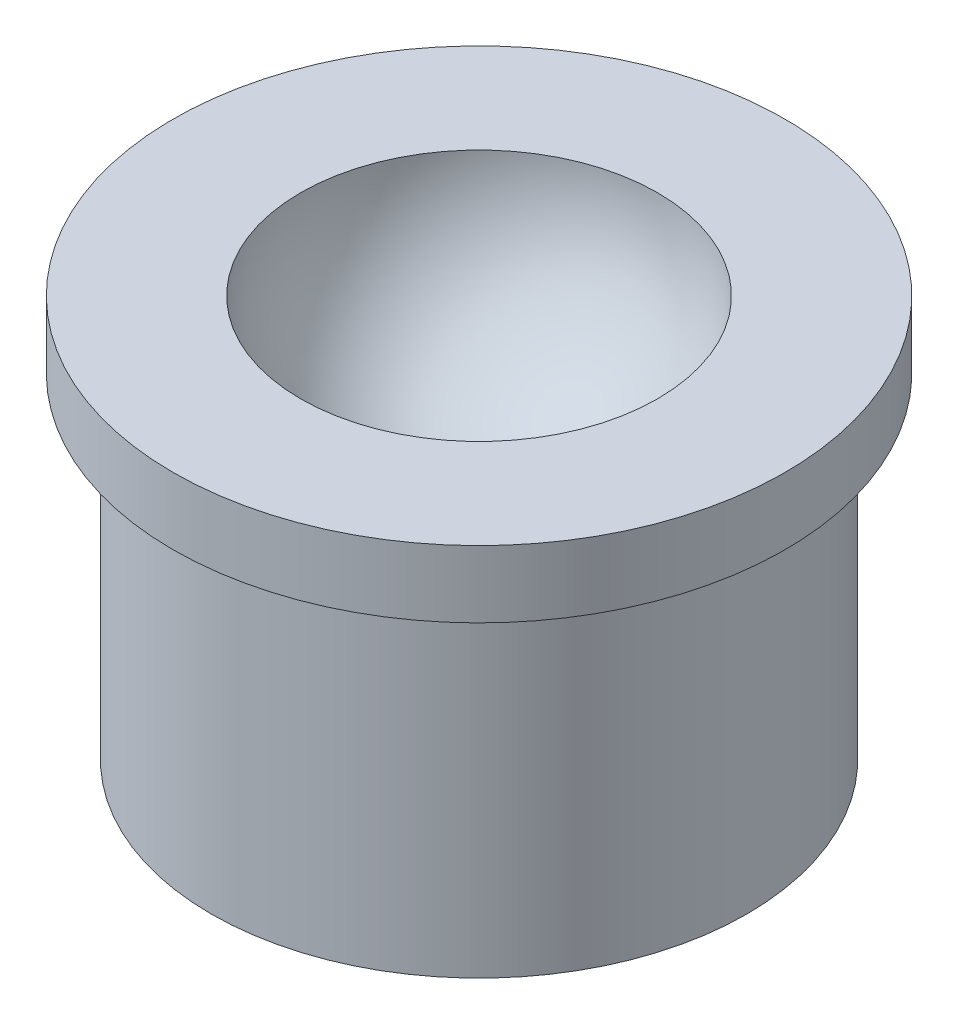
from build123d import *


with BuildPart() as part:
    # Sketch1 → Revolve1 (revolve)
    with BuildSketch(Plane.XY):
        Polygon((0, 0), (6.35, 0), (6.35, 7.9375), (7.257142857, 7.9375), (7.257142857, 9.525), (0, 9.525), align=None)
    revolve(axis=Axis((0, 15.622246456, 0), (0, -1, 0)))

    # Sketch2 → Cut-Revolve3 (revolve, cut)
    with BuildSketch(Plane.XY):
        with BuildLine():
            Line((4.233333333, 9.525), (0, 9.525))
            Line((0, 9.525), (0, 5.291666667))
            ThreePointArc((0, 5.291666667), (2.993418707, 6.531581293), (4.233333333, 9.525))
        make_face()
    revolve(axis=Axis((0, 0, 0), (0, 1, 0)), mode=Mode.SUBTRACT)


solid = part.part
